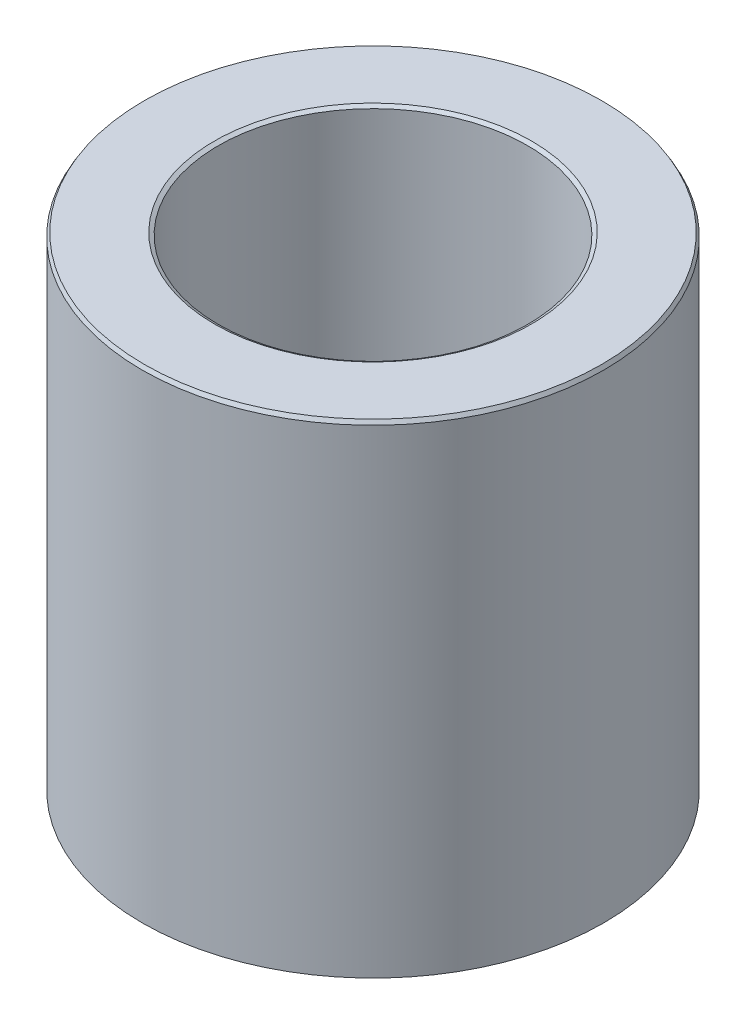
from build123d import *
from OCP.BRepFilletAPI import BRepFilletAPI_MakeChamfer

# Parameters (mm, degrees)
SKETCH1_R           = 27.5
BOSS_EXTRUDE1_DEPTH = 57.761495544
SKETCH2_R           = 18.446674013
CUT_EXTRUDE1_DEPTH  = 70.633974233
CHAMFER1_SIZE       = 0.44915282
CHAMFER1_SIZE2      = 0.259318502


with BuildPart() as part:
    # Sketch1 → Boss-Extrude1 (new body)
    with BuildSketch(Plane(origin=(0, 0, 0), x_dir=(1, 0, 0), z_dir=(0, 1, 0))):
        Circle(SKETCH1_R)
    extrude(amount=BOSS_EXTRUDE1_DEPTH)

    # Sketch2 → Cut-Extrude1 (cut, through all)
    with BuildSketch(Plane(origin=(0, 0, 0), x_dir=(1, 0, 0), z_dir=(0, 1, 0))):
        Circle(SKETCH2_R)
    extrude(amount=CUT_EXTRUDE1_DEPTH, mode=Mode.SUBTRACT)

    # Chamfer1: one chamfer whose edges measure the first distance from different faces: ONE call of the kernel's chamfer builder (chamfer() names one face for all edges)
    chamfer1_edges_1 = [part.edges().sort_by_distance(p)[0] for p in [
        (-18.446674013, 57.761495544, 0),
    ]]
    chamfer1_side_1 = [part.faces().sort_by_distance(p)[0] for p in [
        (-26.722182541, 57.761495544, 0),
    ]]
    chamfer1_edges_2 = [part.edges().sort_by_distance(p)[0] for p in [
        (-18.446674013, 0, 0),
    ]]
    chamfer1_side_2 = [part.faces().sort_by_distance(p)[0] for p in [
        (-18.446674013, 28.880747772, 0),
    ]]
    chamfer1_edges_3 = [part.edges().sort_by_distance(p)[0] for p in [
        (-27.5, 0, 0),
    ]]
    chamfer1_side_3 = [part.faces().sort_by_distance(p)[0] for p in [
        (-26.722182541, 0, 0),
    ]]
    chamfer1_edges_4 = [part.edges().sort_by_distance(p)[0] for p in [
        (-27.5, 57.761495544, 0),
    ]]
    chamfer1_side_4 = [part.faces().sort_by_distance(p)[0] for p in [
        (-27.5, 28.880747772, 0),
    ]]
    chamfer1 = BRepFilletAPI_MakeChamfer(part.part.solid().wrapped)
    for e in chamfer1_edges_1:
        chamfer1.Add(CHAMFER1_SIZE, CHAMFER1_SIZE2, e.wrapped, chamfer1_side_1[0].wrapped)  # the first distance lies on this face
    for e in chamfer1_edges_2:
        chamfer1.Add(CHAMFER1_SIZE, CHAMFER1_SIZE2, e.wrapped, chamfer1_side_2[0].wrapped)  # the first distance lies on this face
    for e in chamfer1_edges_3:
        chamfer1.Add(CHAMFER1_SIZE, CHAMFER1_SIZE2, e.wrapped, chamfer1_side_3[0].wrapped)  # the first distance lies on this face
    for e in chamfer1_edges_4:
        chamfer1.Add(CHAMFER1_SIZE, CHAMFER1_SIZE2, e.wrapped, chamfer1_side_4[0].wrapped)  # the first distance lies on this face
    add(Compound.cast(chamfer1.Shape()), mode=Mode.REPLACE)


solid = part.part
